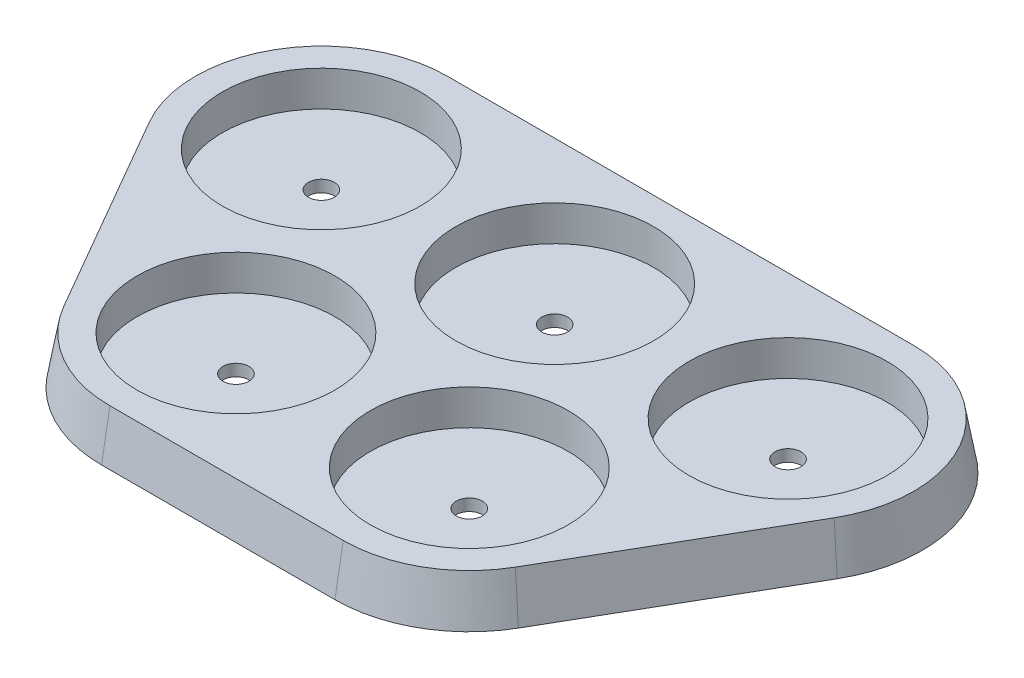
from build123d import *

# Parameters (mm, degrees)
BOSS_EXTRUDE1_DEPTH = 4
BOSS_EXTRUDE1_TAPER = 10
CUT_EXTRUDE1_START  = 4
SKETCH1_3_R         = 1.1
CUT_EXTRUDE1_DEPTH  = 4
CUT_EXTRUDE2_START  = 4
SKETCH1_4_R         = 8.4
SKETCH1_4_R_2       = 1.1
CUT_EXTRUDE2_DEPTH  = 3


with BuildPart() as part:
    # Sketch1 → Boss-Extrude1 (new body)
    with BuildSketch(Plane(origin=(0, 0, 0), x_dir=(1, 0, 0), z_dir=(0, 1, 0))):
        with BuildLine():
            Line((-49.472689603, -5.7), (-39.572689603, -22.847302995))
            ThreePointArc((-39.572689603, -22.847302995), (-35.4, -27.019992598), (-29.7, -28.547302995))
            Line((-29.7, -28.547302995), (-9.9, -28.547302995))
            ThreePointArc((-9.9, -28.547302995), (-4.2, -27.019992598), (-0.027310397, -22.847302995))
            Line((-0.027310397, -22.847302995), (9.872689603, -5.7))
            ThreePointArc((9.872689603, -5.7), (9.872689603, 5.7), (0, 11.4))
            Line((0, 11.4), (-39.6, 11.4))
            ThreePointArc((-39.6, 11.4), (-49.472689603, 5.7), (-49.472689603, -5.7))
        make_face()
    extrude(amount=BOSS_EXTRUDE1_DEPTH, taper=BOSS_EXTRUDE1_TAPER)

    # Sketch1<3> → Cut-Extrude1 (cut)
    with BuildSketch(Plane(origin=(0, 0, 0), x_dir=(1, 0, 0), z_dir=(0, 1, 0)).offset(CUT_EXTRUDE1_START)):
        with Locations(Location((-9.9, -17.147302995, 0), (0, 0, 270))):
            Circle(SKETCH1_3_R)
        with Locations(Location((0, 0, 0), (0, 0, 270))):
            Circle(SKETCH1_3_R)
        with Locations(Location((-29.7, -17.147302995, 0), (0, 0, 270))):
            Circle(SKETCH1_3_R)
        with Locations(Location((-39.6, 0, 0), (0, 0, 270))):
            Circle(SKETCH1_3_R)
        with Locations(Location((-19.8, 0, 0), (0, 0, 270))):
            Circle(SKETCH1_3_R)
    extrude(amount=-CUT_EXTRUDE1_DEPTH, mode=Mode.SUBTRACT)

    # Sketch1<4> → Cut-Extrude2 (cut)
    # profile 1 of 5: a face of its own
    with BuildSketch(Plane(origin=(0, 0, 0), x_dir=(1, 0, 0), z_dir=(0, 1, 0)).offset(CUT_EXTRUDE2_START)):
        with Locations(Location((-19.8, 0, 0), (0, 0, 270))):
            Circle(SKETCH1_4_R)
        with Locations(Location((-19.8, 0, 0), (0, 0, 270))):
            Circle(SKETCH1_4_R_2, mode=Mode.SUBTRACT)
    # profile 2 of 5: a face of its own
    with BuildSketch(Plane(origin=(0, 0, 0), x_dir=(1, 0, 0), z_dir=(0, 1, 0)).offset(CUT_EXTRUDE2_START)):
        with Locations(Location((-9.9, -17.147302995, 0), (0, 0, 270))):
            Circle(SKETCH1_4_R)
        with Locations(Location((-9.9, -17.147302995, 0), (0, 0, 270))):
            Circle(SKETCH1_4_R_2, mode=Mode.SUBTRACT)
    # profile 3 of 5: a face of its own
    with BuildSketch(Plane(origin=(0, 0, 0), x_dir=(1, 0, 0), z_dir=(0, 1, 0)).offset(CUT_EXTRUDE2_START)):
        with Locations(Location((0, 0, 0), (0, 0, 270))):
            Circle(SKETCH1_4_R)
        with Locations(Location((0, 0, 0), (0, 0, 270))):
            Circle(SKETCH1_4_R_2, mode=Mode.SUBTRACT)
    # profile 4 of 5: a face of its own
    with BuildSketch(Plane(origin=(0, 0, 0), x_dir=(1, 0, 0), z_dir=(0, 1, 0)).offset(CUT_EXTRUDE2_START)):
        with Locations(Location((-29.7, -17.147302995, 0), (0, 0, 270))):
            Circle(SKETCH1_4_R)
        with Locations(Location((-29.7, -17.147302995, 0), (0, 0, 270))):
            Circle(SKETCH1_4_R_2, mode=Mode.SUBTRACT)
    # profile 5 of 5: a face of its own
    with BuildSketch(Plane(origin=(0, 0, 0), x_dir=(1, 0, 0), z_dir=(0, 1, 0)).offset(CUT_EXTRUDE2_START)):
        with Locations(Location((-39.6, 0, 0), (0, 0, 270))):
            Circle(SKETCH1_4_R)
        with Locations(Location((-39.6, 0, 0), (0, 0, 270))):
            Circle(SKETCH1_4_R_2, mode=Mode.SUBTRACT)
    extrude(amount=-CUT_EXTRUDE2_DEPTH, mode=Mode.SUBTRACT)


solid = part.part
